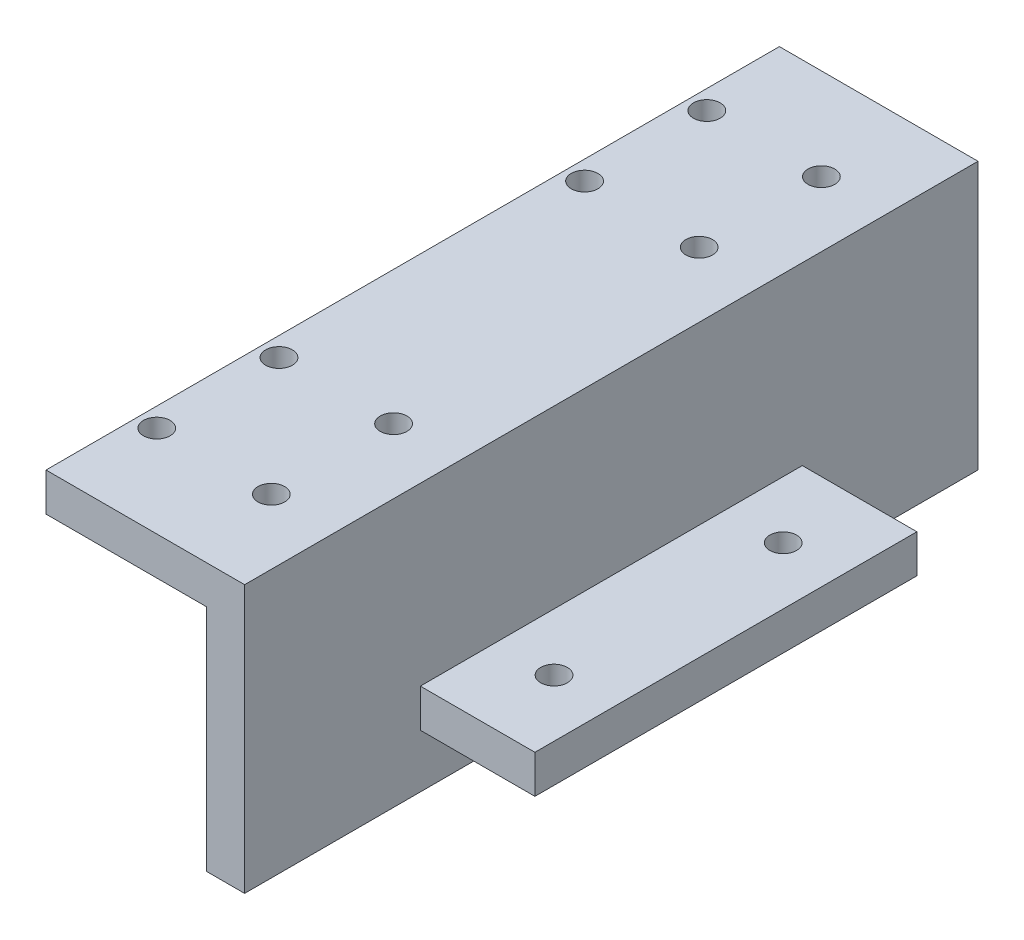
from build123d import *

# Parameters (mm, degrees)
SKETCH1_R           = 1.75
BOSS_EXTRUDE1_DEPTH = 5
SKETCH2_W           = 96
SKETCH2_H           = 35
BOSS_EXTRUDE2_DEPTH = 5
SKETCH3_W           = 50
SKETCH3_H           = 5
BOSS_EXTRUDE3_DEPTH = 15
SKETCH4_R           = 1.75
CUT_EXTRUDE1_DEPTH  = 62.595454378


with BuildPart() as part:
    # Sketch1 → Boss-Extrude1 (new body)
    with BuildSketch(Plane(origin=(0, 0, 0), x_dir=(1, 0, 0), z_dir=(0, 1, 0))):
        Polygon((-10, 48), (10, 48), (11, 48), (11, -48), (10, -48), (-10, -48), align=None)
        with Locations((-7.5, 36)):
            Circle(SKETCH1_R, mode=Mode.SUBTRACT)
        with Locations((7.5, 36)):
            Circle(SKETCH1_R, mode=Mode.SUBTRACT)
        with Locations((-7.5, 20)):
            Circle(SKETCH1_R, mode=Mode.SUBTRACT)
        with Locations((7.5, 20)):
            Circle(SKETCH1_R, mode=Mode.SUBTRACT)
        with Locations((7.5, -20)):
            Circle(SKETCH1_R, mode=Mode.SUBTRACT)
        with Locations((-7.5, -20)):
            Circle(SKETCH1_R, mode=Mode.SUBTRACT)
        with Locations((7.5, -36)):
            Circle(SKETCH1_R, mode=Mode.SUBTRACT)
        with Locations((-7.5, -36)):
            Circle(SKETCH1_R, mode=Mode.SUBTRACT)
    extrude(amount=BOSS_EXTRUDE1_DEPTH)

    # Sketch2 → Boss-Extrude2 (add)
    with BuildSketch(Plane(origin=(11, 0, 0), x_dir=(0, 0, -1), z_dir=(1, 0, 0))):
        with Locations((0, -12.5)):
            Rectangle(SKETCH2_W, SKETCH2_H)
    extrude(amount=BOSS_EXTRUDE2_DEPTH)

    # Sketch3 → Boss-Extrude3 (add)
    with BuildSketch(Plane(origin=(16, 0, 0), x_dir=(0, 0, -1), z_dir=(1, 0, 0))):
        with Locations((0, -20.5)):
            Rectangle(SKETCH3_W, SKETCH3_H)
    extrude(amount=BOSS_EXTRUDE3_DEPTH)

    # Sketch4 → Cut-Extrude1 (cut, through all)
    with BuildSketch(Plane(origin=(0, -18, 0), x_dir=(1, 0, 0), z_dir=(0, 1, 0))):
        with Locations((23.5, 15)):
            Circle(SKETCH4_R)
        with Locations((23.5, -15)):
            Circle(SKETCH4_R)
    extrude(amount=-CUT_EXTRUDE1_DEPTH, mode=Mode.SUBTRACT)


solid = part.part
